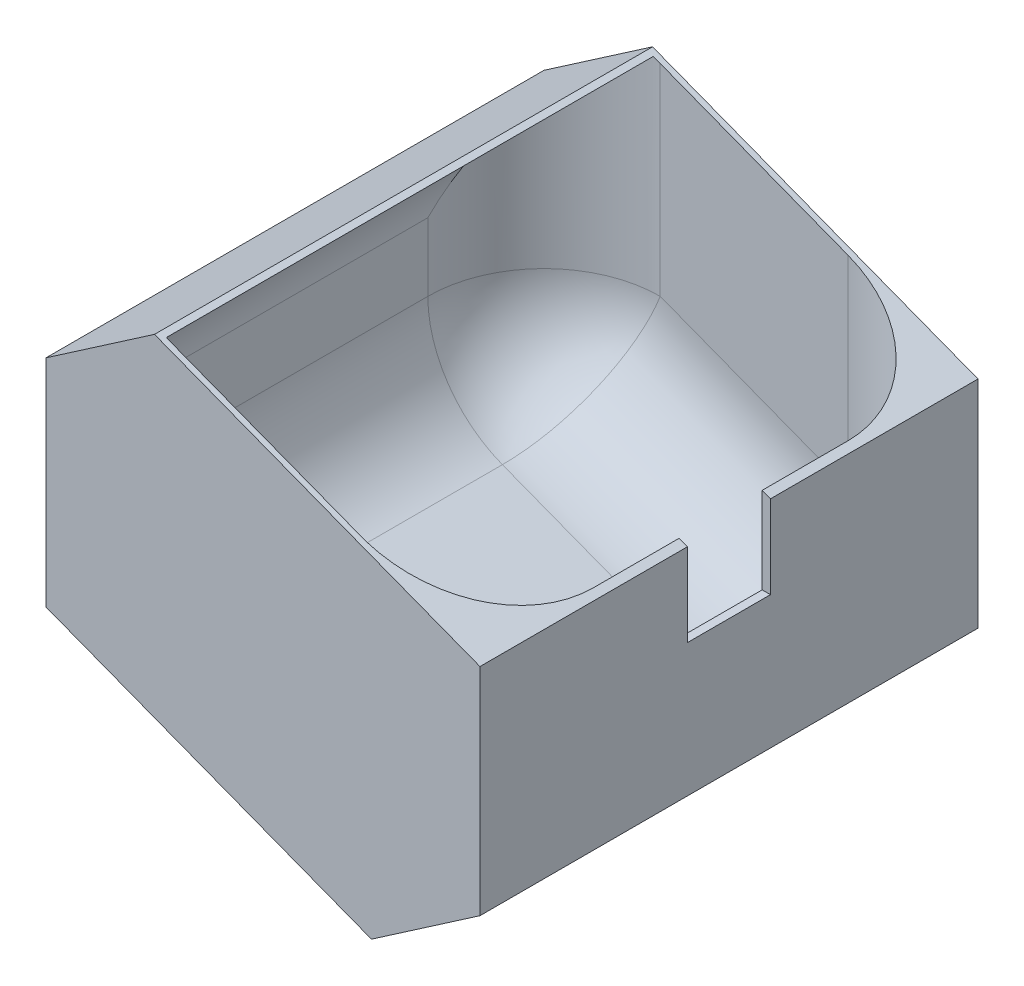
from build123d import *

# Parameters (mm, degrees)
BOSS_EXTRUDE1_DEPTH = 38.1
CUT_EXTRUDE1_DEPTH  = 98.457965419
SHELL1_START        = -37.25333418
SHELL1_DEPTH        = 74.50666836
FILLET1_R           = 17.78
SKETCH3_W           = 12.7
SKETCH3_H           = 13.97
CUT_EXTRUDE2_DEPTH  = 2.54


# Read off the part's stored shape, not the designer's step: Shell1
with BuildPart() as part:
    # Sketch1 → Boss-Extrude1 (new, symmetric)
    with BuildSketch(Plane.XY):
        Polygon((-33.198119966, 25.4), (-33.198119966, -25.4), (33.198119966, -50.887128572), (33.198119966, -0.087128572), align=None)
    extrude(amount=BOSS_EXTRUDE1_DEPTH, both=True)

    # Sketch2 → Cut-Extrude1 (cut, through all)
    with BuildSketch(Plane.XY.offset(38.1)):
        Polygon((16.599059983, -44.515346429), (33.198119966, -33.107128572), (33.198119966, -50.887128572), align=None)
        Polygon((-16.599059983, 19.028217857), (-33.198119966, 25.4), (-33.198119966, 7.62), align=None)
    extrude(amount=-CUT_EXTRUDE1_DEPTH, mode=Mode.SUBTRACT)

    # Shell1 outline → Shell1 (cut)
    with BuildSketch(Plane.XY.offset(SHELL1_START)):
        Polygon((-32.351454146, 7.174547563), (-32.351454146, -24.818102704), (16.486612201, -43.565279915), (31.928119966, -32.952625656), (31.928119966, 0.400378753), (-15.639946381, 18.66004864), align=None)
    extrude(amount=SHELL1_DEPTH, mode=Mode.SUBTRACT)

    # Fillet1
    # the kernel refuses this fillet: 17.78 mm, written as the material it adds along each edge
    with BuildSketch(Plane(origin=(-14.571454146, -12.59824726, -19.47333418), x_dir=(-1, 0, 0), z_dir=(0, 0, -1))) as fillet1_piece_1_section:
        Polygon((0, 0), (FILLET1_R * 1.02, 0), (FILLET1_R * 1.02, -FILLET1_R * 0.701026577777), (FILLET1_R * 0.365535308531, -FILLET1_R * 0.952252035029), align=None)
    fillet1_piece_1 = extrude(amount=FILLET1_R * 1.02, mode=Mode.PRIVATE)
    fillet1_piece_1 = fillet1_piece_1 - Plane(origin=(-14.571454146, -12.59824726, -19.47333418), x_dir=(0.8241261886205663, 0.5664062369269417, 0), z_dir=(0, 0, -1)) * Sphere(FILLET1_R, mode=Mode.PRIVATE)
    add(fillet1_piece_1)
    with BuildSketch(Plane(origin=(-14.571454146, -12.59824726, 19.47333418), x_dir=(-1, 0, 0), z_dir=(0, 0, 1))) as fillet1_piece_2_section:
        Polygon((0, 0), (FILLET1_R * 1.02, 0), (FILLET1_R * 1.02, FILLET1_R * 0.701026577777), (FILLET1_R * 0.365535308531, FILLET1_R * 0.952252035029), align=None)
    fillet1_piece_2 = extrude(amount=FILLET1_R * 1.02, mode=Mode.PRIVATE)
    fillet1_piece_2 = fillet1_piece_2 - Plane(origin=(-14.571454146, -12.59824726, 19.47333418), x_dir=(0.8241261886205663, 0.5664062369269417, 0), z_dir=(0, 0, 1)) * Sphere(FILLET1_R, mode=Mode.PRIVATE)
    add(fillet1_piece_2)
    with BuildSketch(Plane(origin=(-20.943236289, -29.197307243, -37.25333418), x_dir=(0.3583679495405225, 0.9335804264990358, 0), z_dir=(0.9335804264990358, -0.3583679495405224, 0))) as fillet1_piece_3_section:
        with BuildLine():
            CenterArc((FILLET1_R, FILLET1_R), FILLET1_R, 180, 90)
            Line((0, FILLET1_R), (0, 0))
            Line((0, 0), (FILLET1_R, 0))
        make_face()
    fillet1_piece_3 = extrude(amount=84.542794822, mode=Mode.PRIVATE)
    fillet1_piece_3 = split(fillet1_piece_3, bisect_by=Plane(origin=(31.928119966, -33.01813641, -33.386694553), z_dir=(-1, 0, 0)), keep=Keep.TOP, mode=Mode.PRIVATE)
    fillet1_piece_3 = split(fillet1_piece_3, bisect_by=Plane(origin=(10.612775853, -47.602255791, -33.386694553), z_dir=(-0.5664062369254325, 0.8241261886216036, 0)), keep=Keep.TOP, mode=Mode.PRIVATE)
    add(fillet1_piece_3)
    with BuildSketch(Plane(origin=(31.928119966, -77.402625656, -37.25333418), x_dir=(-1, 0, 0), z_dir=(0, 1, 0))) as fillet1_piece_4_section:
        with BuildLine():
            CenterArc((FILLET1_R, FILLET1_R), FILLET1_R, 180, 90)
            Line((0, FILLET1_R), (0, 0))
            Line((0, 0), (FILLET1_R, 0))
        make_face()
    fillet1_piece_4 = extrude(amount=122.253004409, mode=Mode.PRIVATE)
    fillet1_piece_4 = split(fillet1_piece_4, bisect_by=Plane(origin=(33.987840467, -0.39027387, -33.467977185), z_dir=(-0.3583679495453051, -0.9335804264972, 0)), keep=Keep.TOP, mode=Mode.PRIVATE)
    fillet1_piece_4 = split(fillet1_piece_4, bisect_by=Plane(origin=(17.295340959, -43.875721799, -33.467977185), z_dir=(0.3583679495405224, 0.9335804264990358, 0)), keep=Keep.TOP, mode=Mode.PRIVATE)
    fillet1_piece_4 = split(fillet1_piece_4, bisect_by=Plane(origin=(36.497116542, -29.812441309, -33.467977185), z_dir=(-0.5664062369254325, 0.8241261886216036, 0)), keep=Keep.TOP, mode=Mode.PRIVATE)
    add(fillet1_piece_4)
    with BuildSketch(Plane(origin=(-32.351454146, 51.624547563, 37.25333418), x_dir=(1, 0, 0), z_dir=(0, -1, 0))) as fillet1_piece_5_section:
        with BuildLine():
            CenterArc((FILLET1_R, -FILLET1_R), FILLET1_R, 90, 90)
            Line((0, -FILLET1_R), (0, 0))
            Line((0, 0), (FILLET1_R, 0))
        make_face()
    fillet1_piece_5 = extrude(amount=64.222794823, mode=Mode.PRIVATE)
    fillet1_piece_5 = split(fillet1_piece_5, bisect_by=Plane(origin=(-19.793272657, 20.254361223, 33.481549938), z_dir=(-0.3583679495453051, -0.9335804264972, 0)), keep=Keep.TOP, mode=Mode.PRIVATE)
    fillet1_piece_5 = split(fillet1_piece_5, bisect_by=Plane(origin=(-33.346924572, 6.490379695, 33.481549938), z_dir=(0.5664062369446778, -0.8241261886083766, 0)), keep=Keep.TOP, mode=Mode.PRIVATE)
    add(fillet1_piece_5)
    with BuildSketch(Plane(origin=(-20.943236289, -29.197307243, 37.25333418), x_dir=(0.3583679495405225, 0.9335804264990358, 0), z_dir=(0.9335804264990358, -0.3583679495405224, 0))) as fillet1_piece_6_section:
        with BuildLine():
            CenterArc((FILLET1_R, -FILLET1_R), FILLET1_R, 90, 90)
            Line((0, -FILLET1_R), (0, 0))
            Line((0, 0), (FILLET1_R, 0))
        make_face()
    fillet1_piece_6 = extrude(amount=84.542794822, mode=Mode.PRIVATE)
    fillet1_piece_6 = split(fillet1_piece_6, bisect_by=Plane(origin=(31.928119966, -33.01813641, 33.386694553), z_dir=(-1, 0, 0)), keep=Keep.TOP, mode=Mode.PRIVATE)
    fillet1_piece_6 = split(fillet1_piece_6, bisect_by=Plane(origin=(10.612775853, -47.602255791, 33.386694553), z_dir=(-0.5664062369254325, 0.8241261886216036, 0)), keep=Keep.TOP, mode=Mode.PRIVATE)
    add(fillet1_piece_6)
    with BuildSketch(Plane(origin=(31.928119966, -77.402625656, 37.25333418), x_dir=(-1, 0, 0), z_dir=(0, 1, 0))) as fillet1_piece_7_section:
        with BuildLine():
            CenterArc((FILLET1_R, -FILLET1_R), FILLET1_R, 90, 90)
            Line((0, -FILLET1_R), (0, 0))
            Line((0, 0), (FILLET1_R, 0))
        make_face()
    fillet1_piece_7 = extrude(amount=122.253004409, mode=Mode.PRIVATE)
    fillet1_piece_7 = split(fillet1_piece_7, bisect_by=Plane(origin=(33.987840467, -0.39027387, 33.467977185), z_dir=(-0.3583679495453051, -0.9335804264972, 0)), keep=Keep.TOP, mode=Mode.PRIVATE)
    fillet1_piece_7 = split(fillet1_piece_7, bisect_by=Plane(origin=(17.295340959, -43.875721799, 33.467977185), z_dir=(0.3583679495405224, 0.9335804264990358, 0)), keep=Keep.TOP, mode=Mode.PRIVATE)
    fillet1_piece_7 = split(fillet1_piece_7, bisect_by=Plane(origin=(36.497116542, -29.812441309, 33.467977185), z_dir=(-0.5664062369254325, 0.8241261886216036, 0)), keep=Keep.TOP, mode=Mode.PRIVATE)
    add(fillet1_piece_7)
    with BuildSketch(Plane(origin=(-32.351454146, -24.818102704, -19.47333418), x_dir=(0, 1, 0), z_dir=(0, 0, 1))) as fillet1_piece_8:
        with BuildLine():
            CenterArc((FILLET1_R * 0.687280958605, -FILLET1_R), FILLET1_R, 90, 69)
            Line((-FILLET1_R * 0.246299467894, -FILLET1_R * 0.641632050459), (0, 0))
            Line((0, 0), (FILLET1_R * 0.687280958605, 0))
        make_face()
    extrude(amount=38.94666836)
    with BuildSketch(Plane(origin=(-32.351454146, 51.624547563, -37.25333418), x_dir=(1, 0, 0), z_dir=(0, -1, 0))) as fillet1_piece_9_section:
        with BuildLine():
            CenterArc((FILLET1_R, FILLET1_R), FILLET1_R, 180, 90)
            Line((0, FILLET1_R), (0, 0))
            Line((0, 0), (FILLET1_R, 0))
        make_face()
    fillet1_piece_9 = extrude(amount=64.222794823, mode=Mode.PRIVATE)
    fillet1_piece_9 = split(fillet1_piece_9, bisect_by=Plane(origin=(-19.793272657, 20.254361223, -33.481549938), z_dir=(-0.3583679495453051, -0.9335804264972, 0)), keep=Keep.TOP, mode=Mode.PRIVATE)
    fillet1_piece_9 = split(fillet1_piece_9, bisect_by=Plane(origin=(-33.346924572, 6.490379695, -33.481549938), z_dir=(0.5664062369446778, -0.8241261886083766, 0)), keep=Keep.TOP, mode=Mode.PRIVATE)
    add(fillet1_piece_9)
    with BuildSketch(Plane(origin=(-32.351454146, 7.174547563, -37.25333418), x_dir=(0.8241261886083765, 0.5664062369446778, 0), z_dir=(0, 0, 1)), Plane(origin=(16.486612201, -43.565279915, -37.25333418), x_dir=(-0.933580426499036, 0.3583679495405219, 0), z_dir=(0, 0, 1))) as fillet1_piece_10:
        with BuildLine():
            CenterArc((FILLET1_R * 0.526125451477, -FILLET1_R), FILLET1_R, 90, 55.499999999)
            Line((-FILLET1_R * 0.298000737132, -FILLET1_R * 0.433593763055), (0, 0))
            Line((0, 0), (FILLET1_R * 0.526125451477, 0))
        make_face()
    extrude(amount=74.50666836)
    with BuildSketch(Plane(origin=(31.928119966, -32.952625656, -37.25333418), x_dir=(0, 1, 0), z_dir=(0, 0, 1))) as fillet1_piece_11:
        with BuildLine():
            CenterArc((FILLET1_R * 0.526125451492, FILLET1_R), FILLET1_R, 214.5, 55.5)
            Line((-FILLET1_R * 0.29800073713, FILLET1_R * 0.433593763075), (0, 0))
            Line((0, 0), (FILLET1_R * 0.526125451492, 0))
        make_face()
    extrude(amount=74.50666836)

    # Sketch3 → Cut-Extrude2 (cut)
    with BuildSketch(Plane(origin=(33.198119966, 0, 0), x_dir=(0, 0, -1), z_dir=(1, 0, 0))):
        with Locations((0, -5.802128572)):
            Rectangle(SKETCH3_W, SKETCH3_H)
    extrude(amount=-CUT_EXTRUDE2_DEPTH, mode=Mode.SUBTRACT)


solid = part.part
